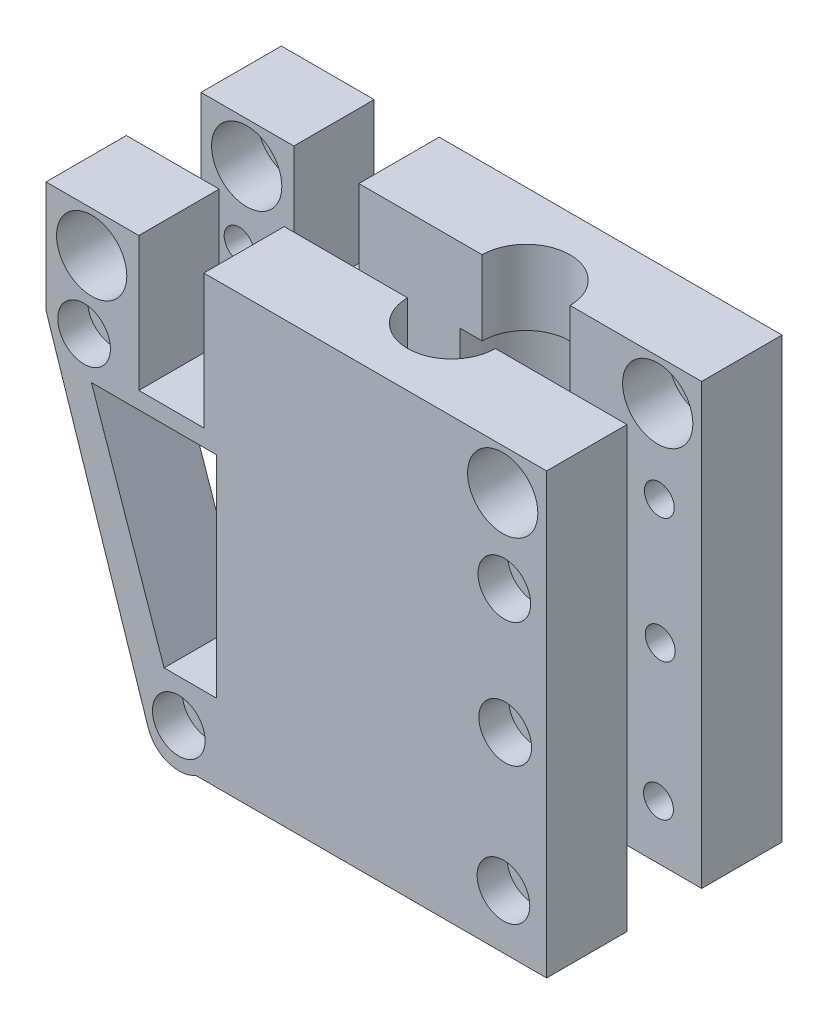
from build123d import *

# Parameters (mm, degrees)
EXTRUDE_1_DEPTH                = 18.3
HOLE_WIZARD_M4_9_OUTLINE_R     = 2.25
HOLE_WIZARD_M4_9_DEPTH         = 18.3
HOLE_WIZARD_M4_9_2_OUTLINE_R   = 4
HOLE_WIZARD_M4_9_2_OUTLINE_R_2 = 2.25
HOLE_WIZARD_M4_9_2_DEPTH       = 4.6
EXTRUDE_START                  = -14.8
SKETCH_10_R                    = 4
SKETCH_10_R_2                  = 2.25
EXTRUDE_3_DEPTH                = 14.8
EXTRUDE_START_2                = -14
SKETCH_10_3_R                  = 4
SKETCH_10_3_R_2                = 2.25
EXTRUDE_4_DEPTH                = 14
SKETCH_10_4_R                  = 4
SKETCH_10_4_R_2                = 2.25
EXTRUDE_5_DEPTH                = 14.4
EXTRUDE_5_2_DEPTH              = 14.4
EXTRUDE_START_3                = 1
SKETCH_12_R                    = 4
SKETCH_12_R_2                  = 2.25
EXTRUDE_6_DEPTH                = 1
HOLE_WIZARD_M3_1_D             = 3.4
HOLE_WIZARD_M3_1_CBORE_D       = 6
HOLE_WIZARD_M3_1_CBORE_DEPTH   = 3.4
SKETCH_15_R                    = 7.5
EXTRUDE_7_DEPTH                = 44
EXTRUDE_8_DEPTH                = 14
EXTRUDE_8_DEPTH_BACK           = 75
SKETCH_15_2_R                  = 7.5
SKETCH_15_3_R                  = 7.5
EXTRUDE_9_DEPTH                = 8.5
EXTRUDE_START_4                = -8.5
SKETCH_16_R                    = 7.5
EXTRUDE_10_DEPTH               = 8.5
EXTRUDE_11_DEPTH               = 14
EXTRUDE_11_DEPTH_BACK          = 67.5
SKETCH_17_R                    = 5
SPLIT_BODIES_1_SURFACE_1_BACK  = 79.332
SPLIT_BODIES_1_SURFACE_1_DEPTH = 158.664
SPLIT_BODIES_1_SURFACE_2_BACK  = 79.332
SPLIT_BODIES_1_SURFACE_2_DEPTH = 158.664


with BuildPart() as part:
    # 草图1 → 凸台-拉伸1 (new body)
    with BuildSketch(Plane.XY):
        with BuildLine():
            Line((0, -50), (-33.757928075, -50))
            ThreePointArc((-33.757928075, -50), (-36.949828603, -50.281899468), (-39.169027754, -47.970438583))
            Line((-39.169027754, -47.970438583), (-50.789428367, -12.681899647))
            Line((-50.789428367, -12.681899647), (-50.789428367, 0))
            Line((-50.789428367, 0), (-40.21990991, 0))
            Line((-40.21990991, 0), (-40.21990991, -15.275201138))
            Line((-40.21990991, -15.275201138), (-32.81990991, -15.275201138))
            Line((-32.81990991, -15.275201138), (-32.81990991, 0))
            Line((-32.81990991, 0), (0, 0))
            Line((0, 0), (6.210571633, 0))
            Line((6.210571633, 0), (6.210571633, -50))
            Line((6.210571633, -50), (0, -50))
        make_face()
        Polygon((-31.4, -17.2), (-31.4, -41.2), (-37.342185184, -41.2), (-45.618487459, -17.2), align=None, mode=Mode.SUBTRACT)
    extrude(amount=EXTRUDE_1_DEPTH)

    # M4 六角圆柱头螺钉的柱形沉头孔9: read off the stored shape, not the designer's step
    # M4 六角圆柱头螺钉的柱形沉头孔9 outline → M4 六角圆柱头螺钉的柱形沉头孔9 (cut)
    with BuildSketch(Plane.XY):
        with Locations((1.210571633, -4.675484087)):
            Circle(HOLE_WIZARD_M4_9_OUTLINE_R)
        with Locations((-45.589428367, -4.675484087)):
            Circle(HOLE_WIZARD_M4_9_OUTLINE_R)
    extrude(amount=HOLE_WIZARD_M4_9_DEPTH, mode=Mode.SUBTRACT)

    # Hole Wizard M4 _9 2 outline → Hole Wizard M4 _9 2 (cut)
    # profile 1 of 2: a face of its own
    with BuildSketch(Plane.XY):
        with Locations((1.210571633, -4.675484087)):
            Circle(HOLE_WIZARD_M4_9_2_OUTLINE_R)
        with Locations((1.210571633, -4.675484087)):
            Circle(HOLE_WIZARD_M4_9_2_OUTLINE_R_2, mode=Mode.SUBTRACT)
    # profile 2 of 2: a face of its own
    with BuildSketch(Plane.XY):
        with Locations((-45.589428367, -4.675484087)):
            Circle(HOLE_WIZARD_M4_9_2_OUTLINE_R)
        with Locations((-45.589428367, -4.675484087)):
            Circle(HOLE_WIZARD_M4_9_2_OUTLINE_R_2, mode=Mode.SUBTRACT)
    extrude(amount=HOLE_WIZARD_M4_9_2_DEPTH, mode=Mode.SUBTRACT)

    # 草图10 → 凸台-拉伸3 (add)
    # profile 1 of 2: a face of its own
    with BuildSketch(Plane.XY.offset(18.3).offset(EXTRUDE_START)):
        with Locations(Location((-45.589428367, -4.675484087, 0), (0, 0, 180))):
            Circle(SKETCH_10_R)
        with Locations(Location((-45.589428367, -4.675484087, 0), (0, 0, 180))):
            Circle(SKETCH_10_R_2, mode=Mode.SUBTRACT)
    # profile 2 of 2: a face of its own
    with BuildSketch(Plane.XY.offset(18.3).offset(EXTRUDE_START)):
        with Locations(Location((1.210571633, -4.675484087, 0), (0, 0, 180))):
            Circle(SKETCH_10_R)
        with Locations(Location((1.210571633, -4.675484087, 0), (0, 0, 180))):
            Circle(SKETCH_10_R_2, mode=Mode.SUBTRACT)
    extrude(amount=EXTRUDE_3_DEPTH)

    # 草图10<3> → 凸台-拉伸4 (add)
    # profile 1 of 2: a face of its own
    with BuildSketch(Plane.XY.offset(18.3).offset(EXTRUDE_START_2)):
        with Locations(Location((-45.589428367, -4.675484087, 0), (0, 0, 180))):
            Circle(SKETCH_10_3_R)
        with Locations(Location((-45.589428367, -4.675484087, 0), (0, 0, 180))):
            Circle(SKETCH_10_3_R_2, mode=Mode.SUBTRACT)
    # profile 2 of 2: a face of its own
    with BuildSketch(Plane.XY.offset(18.3).offset(EXTRUDE_START_2)):
        with Locations(Location((1.210571633, -4.675484087, 0), (0, 0, 180))):
            Circle(SKETCH_10_3_R)
        with Locations(Location((1.210571633, -4.675484087, 0), (0, 0, 180))):
            Circle(SKETCH_10_3_R_2, mode=Mode.SUBTRACT)
    extrude(amount=EXTRUDE_4_DEPTH)


with BuildPart() as body_2:
    # 草图10<4> → 凸台-拉伸5 (new body)
    with BuildSketch(Plane.XY.offset(18.3)):
        with Locations((-45.589428367, -4.675484087)):
            Circle(SKETCH_10_4_R)
        with Locations((-45.589428367, -4.675484087)):
            Circle(SKETCH_10_4_R_2, mode=Mode.SUBTRACT)
    extrude(amount=-EXTRUDE_5_DEPTH)


with BuildPart() as body_3:
    # 草图10<4> → Extrude 5 2 (new body)
    with BuildSketch(Plane.XY.offset(18.3)):
        with Locations((1.210571633, -4.675484087)):
            Circle(SKETCH_10_4_R)
        with Locations((1.210571633, -4.675484087)):
            Circle(SKETCH_10_4_R_2, mode=Mode.SUBTRACT)
    extrude(amount=-EXTRUDE_5_2_DEPTH)


with BuildPart() as part_1:
    add(part.part)

    # Combine 1: cut body 3, body 2
    add(body_3.part, mode=Mode.SUBTRACT)
    add(body_2.part, mode=Mode.SUBTRACT)

    # 草图12 → 凸台-拉伸6 (add)
    # profile 1 of 2: a face of its own
    with BuildSketch(Plane(origin=(0, 0, 3.5), x_dir=(-1, 0, 0), z_dir=(0, 0, -1)).offset(EXTRUDE_START_3)):
        with Locations((-1.210571633, -4.675484087)):
            Circle(SKETCH_12_R)
        with Locations((-1.210571633, -4.675484087)):
            Circle(SKETCH_12_R_2, mode=Mode.SUBTRACT)
    # profile 2 of 2: a face of its own
    with BuildSketch(Plane(origin=(0, 0, 3.5), x_dir=(-1, 0, 0), z_dir=(0, 0, -1)).offset(EXTRUDE_START_3)):
        with Locations((45.589428367, -4.675484087)):
            Circle(SKETCH_12_R)
        with Locations((45.589428367, -4.675484087)):
            Circle(SKETCH_12_R_2, mode=Mode.SUBTRACT)
    extrude(amount=-EXTRUDE_6_DEPTH)

    # M3 六角圆柱头螺钉的柱形沉头孔1 (through all)
    with Locations(Plane(origin=(-35.673334908, -46.056201731, 18.3), x_dir=(1, 0, 0), z_dir=(0, 0, 1))):
        with Locations((0, 0), (-10.781600809, 33.251395545), (37.066874077, 32.038507969), (37.165273915, 17.918131222), (36.968474239, 2.223357068)):
            CounterBoreHole(HOLE_WIZARD_M3_1_D / 2, HOLE_WIZARD_M3_1_CBORE_D / 2, HOLE_WIZARD_M3_1_CBORE_DEPTH)


with BuildPart() as body_2_2:
    # 草图15 → 凸台-拉伸7 (new body)
    with BuildSketch(Plane.XZ.offset(50)):
        with Locations((-13.773678221, 9.15)):
            Circle(SKETCH_15_R)
    extrude(amount=-EXTRUDE_7_DEPTH)


with BuildPart() as part_2:
    add(part_1.part)

    # Combine 2: cut body 2 2
    add(body_2_2.part, mode=Mode.SUBTRACT)


with BuildPart() as body_2_3:
    # 草图15<2> → 凸台-拉伸8 (new, two sides: drawn at the far end of the back side and taken through both)
    with BuildSketch(Plane.XZ.offset(50).offset(-EXTRUDE_8_DEPTH_BACK)):
        with Locations((-13.773678221, 9.15)):
            Circle(SKETCH_15_2_R)
    extrude(amount=EXTRUDE_8_DEPTH + EXTRUDE_8_DEPTH_BACK)


with BuildPart() as part_3:
    add(part_2.part)

    # Combine 3: cut body 2 3
    add(body_2_3.part, mode=Mode.SUBTRACT)

    # 草图15<3> → 凸台-拉伸9 (add)
    with BuildSketch(Plane.XZ.offset(50)):
        with Locations((-13.773678221, 9.15)):
            Circle(SKETCH_15_3_R)
    extrude(amount=-EXTRUDE_9_DEPTH)

    # 草图16 → 凸台-拉伸10 (add)
    with BuildSketch(Plane(origin=(0, 0, 0), x_dir=(1, 0, 0), z_dir=(0, 1, 0)).offset(EXTRUDE_START_4)):
        with Locations((-13.773678221, -9.15)):
            Circle(SKETCH_16_R)
    extrude(amount=EXTRUDE_10_DEPTH)


with BuildPart() as body_2_4:
    # 草图17 → 凸台-拉伸11 (new, two sides: drawn at the far end of the back side and taken through both)
    with BuildSketch(Plane.XZ.offset(50).offset(-EXTRUDE_11_DEPTH_BACK)):
        with Locations((-13.773678221, 9.15)):
            Circle(SKETCH_17_R)
    extrude(amount=EXTRUDE_11_DEPTH + EXTRUDE_11_DEPTH_BACK)


with BuildPart() as part_4:
    add(part_3.part)

    # Combine 4: cut body 2 4
    add(body_2_4.part, mode=Mode.SUBTRACT)


with BuildPart() as body_2_5:
    # Split Bodies 1: the piece behind the surface
    add(part_4.part)
    # Split Bodies 1 surface: a surface, the sketch's curves swept straight by 158.664 mm
    with BuildLine(Plane(origin=(0, 0, 0), x_dir=(1, 0, 0), z_dir=(0, 1, 0)).offset(-SPLIT_BODIES_1_SURFACE_1_BACK), mode=Mode.PRIVATE) as split_bodies_1_surface_1_path:
        Line((17.739659473, -9.15), (-13.773678221, -9.15))
        Line((-13.773678221, -9.15), (-56.906947056, -9.15))
    split_bodies_1_surface_1 = Shell.extrude(split_bodies_1_surface_1_path.wire(), (0 * SPLIT_BODIES_1_SURFACE_1_DEPTH, 1 * SPLIT_BODIES_1_SURFACE_1_DEPTH, 0 * SPLIT_BODIES_1_SURFACE_1_DEPTH))
    split(bisect_by=split_bodies_1_surface_1, keep=Keep.BOTTOM)


with BuildPart() as part_5:
    add(part_4.part)

    # Split Bodies 1: split by a surface, the side it looks to stays
    # Split Bodies 1 surface: a surface, the sketch's curves swept straight by 158.664 mm
    with BuildLine(Plane(origin=(0, 0, 0), x_dir=(1, 0, 0), z_dir=(0, 1, 0)).offset(-SPLIT_BODIES_1_SURFACE_2_BACK), mode=Mode.PRIVATE) as split_bodies_1_surface_2_path:
        Line((17.739659473, -9.15), (-13.773678221, -9.15))
        Line((-13.773678221, -9.15), (-56.906947056, -9.15))
    split_bodies_1_surface_2 = Shell.extrude(split_bodies_1_surface_2_path.wire(), (0 * SPLIT_BODIES_1_SURFACE_2_DEPTH, 1 * SPLIT_BODIES_1_SURFACE_2_DEPTH, 0 * SPLIT_BODIES_1_SURFACE_2_DEPTH))
    split(bisect_by=split_bodies_1_surface_2, keep=Keep.TOP)


with BuildPart() as body_2_5_1:
    # Move Body 1: read off the stored shape, not the designer's step
    # Move Body 1: moved
    add(body_2_5.part.moved(Location((0, 0, -8.4997527))))


solid = Compound([part_5.part, body_2_5_1.part])
